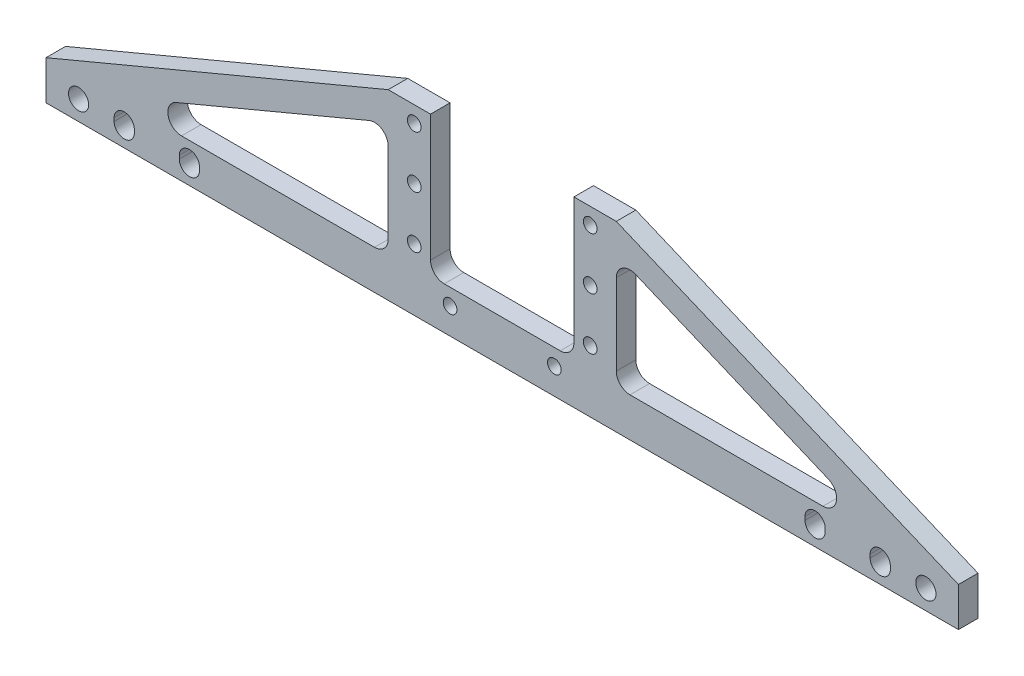
from build123d import *

# Parameters (mm, degrees)
SKETCH_1_R          = 1.05
SKETCH_1_R_2        = 1.55
EXTRUDE_1_DEPTH     = 3
SKETCH_2_R          = 1.55
CUT_EXTRUDE_1_DEPTH = 3
CUT_EXTRUDE_2_DEPTH = 75.060785845


with BuildPart() as part:
    # ｽｹｯﾁ1 → ﾎﾞｽ - 押し出し1 (new body)
    with BuildSketch(Plane.XY):
        with BuildLine():
            Line((-11, 4.6), (-11, 24))
            Line((-11, 24), (-17.5, 24))
            Line((-17.5, 24), (-70, 2))
            Line((-70, 2), (-70, -4))
            Line((-70, -4), (-17.5, -4))
            Line((-17.5, -4), (17.5, -4))
            Line((17.5, -4), (70, -4))
            Line((70, -4), (70, 2))
            Line((70, 2), (17.5, 24))
            Line((17.5, 24), (11, 24))
            Line((11, 24), (11, 4.6))
            ThreePointArc((11, 4.6), (10.38492424, 3.11507576), (8.9, 2.5))
            Line((8.9, 2.5), (-8.9, 2.5))
            ThreePointArc((-8.9, 2.5), (-10.38492424, 3.11507576), (-11, 4.6))
        make_face()
        with Locations((-13.5, 5.5)):
            Circle(SKETCH_1_R, mode=Mode.SUBTRACT)
        with Locations((-8, 0)):
            Circle(SKETCH_1_R, mode=Mode.SUBTRACT)
        with Locations((8, 0)):
            Circle(SKETCH_1_R, mode=Mode.SUBTRACT)
        with Locations((-13.5, 13.5)):
            Circle(SKETCH_1_R, mode=Mode.SUBTRACT)
        with Locations((-13.5, 21.5)):
            Circle(SKETCH_1_R, mode=Mode.SUBTRACT)
        with Locations((13.5, 21.5)):
            Circle(SKETCH_1_R, mode=Mode.SUBTRACT)
        with Locations((13.5, 13.5)):
            Circle(SKETCH_1_R, mode=Mode.SUBTRACT)
        with Locations((13.5, 5.5)):
            Circle(SKETCH_1_R, mode=Mode.SUBTRACT)
        with Locations((-65, -1)):
            Circle(SKETCH_1_R_2, mode=Mode.SUBTRACT)
        with Locations((65, -1)):
            Circle(SKETCH_1_R_2, mode=Mode.SUBTRACT)
        with BuildLine():
            Line((-17.5, 4.1), (-17.5, 16.506066998))
            ThreePointArc((-17.5, 16.506066998), (-18.436901101, 18.254552329), (-20.411619954, 18.442887344))
            Line((-20.411619954, 18.442887344), (-50.017007109, 6.036820345))
            ThreePointArc((-50.017007109, 6.036820345), (-51.264188108, 3.686069284), (-49.205387155, 2))
            Line((-49.205387155, 2), (-19.6, 2))
            ThreePointArc((-19.6, 2), (-18.11507576, 2.61507576), (-17.5, 4.1))
        make_face(mode=Mode.SUBTRACT)
        with BuildLine():
            Line((20.411619954, 18.442887344), (50.017007109, 6.036820345))
            ThreePointArc((50.017007109, 6.036820345), (51.264188108, 3.686069284), (49.205387155, 2))
            Line((49.205387155, 2), (19.6, 2))
            ThreePointArc((19.6, 2), (18.11507576, 2.61507576), (17.5, 4.1))
            Line((17.5, 4.1), (17.5, 16.506066998))
            ThreePointArc((17.5, 16.506066998), (18.436901101, 18.254552329), (20.411619954, 18.442887344))
        make_face(mode=Mode.SUBTRACT)
    extrude(amount=EXTRUDE_1_DEPTH)

    # ｽｹｯﾁ2 → ｶｯﾄ - 押し出し1 (cut)
    with BuildSketch(Plane.XY.offset(3)):
        with Locations((-48, -1)):
            Circle(SKETCH_2_R)
        with Locations((48, -1)):
            Circle(SKETCH_2_R)
        with Locations((-58, -1)):
            Circle(SKETCH_2_R)
        with Locations((58, -1)):
            Circle(SKETCH_2_R)
    extrude(amount=-CUT_EXTRUDE_1_DEPTH, mode=Mode.SUBTRACT)

    # ｽｹｯﾁ3 → ｶｯﾄ - 押し出し2 (cut, through all)
    with BuildSketch(Plane(origin=(0, 0, 0), x_dir=(-1, 0, 0), z_dir=(0, 0, -1))):
        with BuildLine():
            Line((-56.45, -0.75), (-56.45, -1.25))
            ThreePointArc((-56.45, -1.25), (-58, -2.8), (-59.55, -1.25))
            Line((-59.55, -1.25), (-59.55, -0.75))
            ThreePointArc((-59.55, -0.75), (-58, 0.8), (-56.45, -0.75))
        make_face()
        with BuildLine():
            Line((-46.45, -0.75), (-46.45, -1.25))
            ThreePointArc((-46.45, -1.25), (-48, -2.8), (-49.55, -1.25))
            Line((-49.55, -1.25), (-49.55, -0.75))
            ThreePointArc((-49.55, -0.75), (-48, 0.8), (-46.45, -0.75))
        make_face()
        with BuildLine():
            Line((56.45, -0.75), (56.45, -1.25))
            ThreePointArc((56.45, -1.25), (58, -2.8), (59.55, -1.25))
            Line((59.55, -1.25), (59.55, -0.75))
            ThreePointArc((59.55, -0.75), (58, 0.8), (56.45, -0.75))
        make_face()
        with BuildLine():
            Line((46.45, -0.75), (46.45, -1.25))
            ThreePointArc((46.45, -1.25), (48, -2.8), (49.55, -1.25))
            Line((49.55, -1.25), (49.55, -0.75))
            ThreePointArc((49.55, -0.75), (48, 0.8), (46.45, -0.75))
        make_face()
    extrude(amount=-CUT_EXTRUDE_2_DEPTH, mode=Mode.SUBTRACT)


solid = part.part
